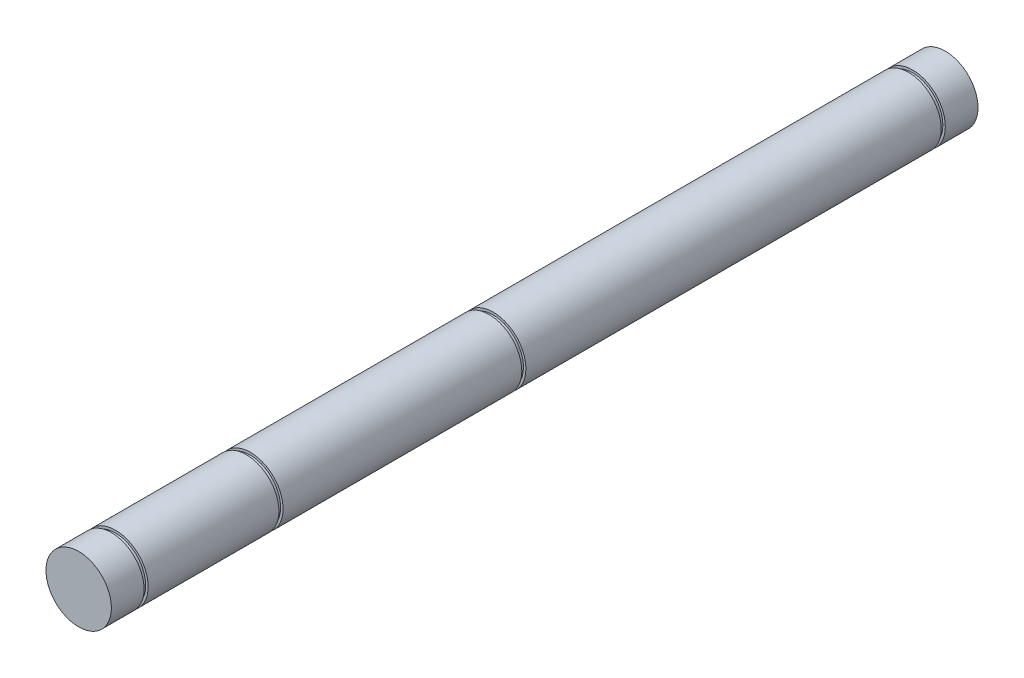
from build123d import *

# Parameters (mm, degrees)
CROQUIS1_R              = 2
SALIENTE_EXTRUIR1_DEPTH = 53
CROQUIS2_W              = 0.25
CROQUIS2_H              = 2


with BuildPart() as part:
    # Croquis1 → Saliente-Extruir1 (new body)
    with BuildSketch(Plane.XY):
        Circle(CROQUIS1_R)
    extrude(amount=SALIENTE_EXTRUIR1_DEPTH)

    # Croquis2 → Cortar-Revolución1 (revolve, cut)
    with BuildSketch(Plane(origin=(0, 0, 0), x_dir=(0, 0, -1), z_dir=(1, 0, 0))):
        with Locations((-50.875, 2.85)):
            Rectangle(CROQUIS2_W, CROQUIS2_H)
        with Locations((-42.625, 2.85)):
            Rectangle(CROQUIS2_W, CROQUIS2_H)
        with Locations((-2.125, 2.85)):
            Rectangle(CROQUIS2_W, CROQUIS2_H)
        with Locations((-27.775, 2.85)):
            Rectangle(CROQUIS2_W, CROQUIS2_H)
    revolve(axis=Axis((0, 0, 0), (0, 0, 1)), mode=Mode.SUBTRACT)


solid = part.part
